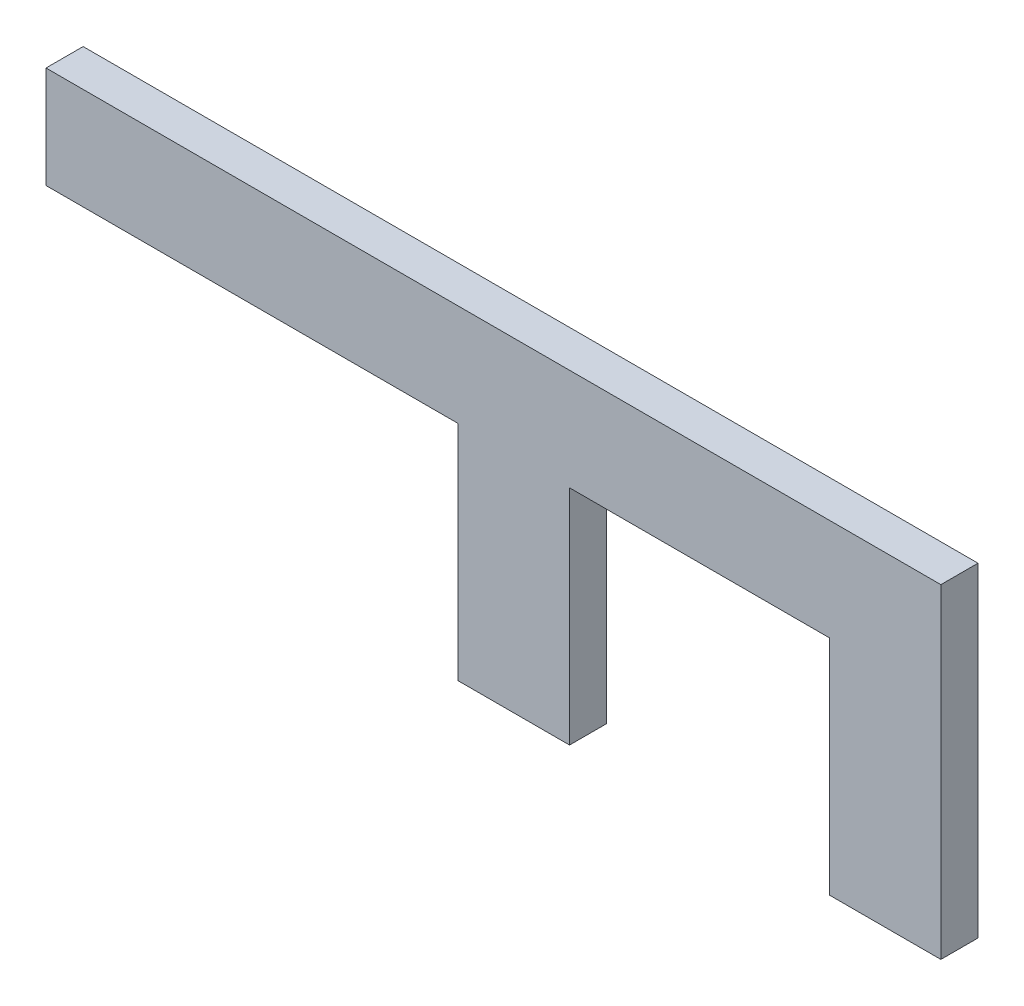
from build123d import *

# Parameters (mm, degrees)
SKETCH1_W           = 240.990546047
SKETCH1_H           = 27.416059312
BOSS_EXTRUDE1_DEPTH = 10
SKETCH2_W           = 30
SKETCH2_H           = 10
BOSS_EXTRUDE2_DEPTH = 60
SKETCH3_W           = 30
SKETCH3_H           = 10
BOSS_EXTRUDE3_DEPTH = 60


with BuildPart() as part:
    # Sketch1 → Boss-Extrude1 (new body)
    with BuildSketch(Plane.XY):
        with Locations((120.495273024, -13.708029656)):
            Rectangle(SKETCH1_W, SKETCH1_H)
    extrude(amount=BOSS_EXTRUDE1_DEPTH)

    # Sketch2 → Boss-Extrude2 (add)
    with BuildSketch(Plane(origin=(0, -27.416059312, 0), x_dir=(-1, 0, 0), z_dir=(0, -1, 0))):
        with Locations((-225.990546047, -5)):
            Rectangle(SKETCH2_W, SKETCH2_H)
    extrude(amount=BOSS_EXTRUDE2_DEPTH)

    # Sketch3 → Boss-Extrude3 (add)
    with BuildSketch(Plane(origin=(0, -27.416059312, 0), x_dir=(-1, 0, 0), z_dir=(0, -1, 0))):
        with Locations((-125.990546047, -5)):
            Rectangle(SKETCH3_W, SKETCH3_H)
    extrude(amount=BOSS_EXTRUDE3_DEPTH)


solid = part.part
